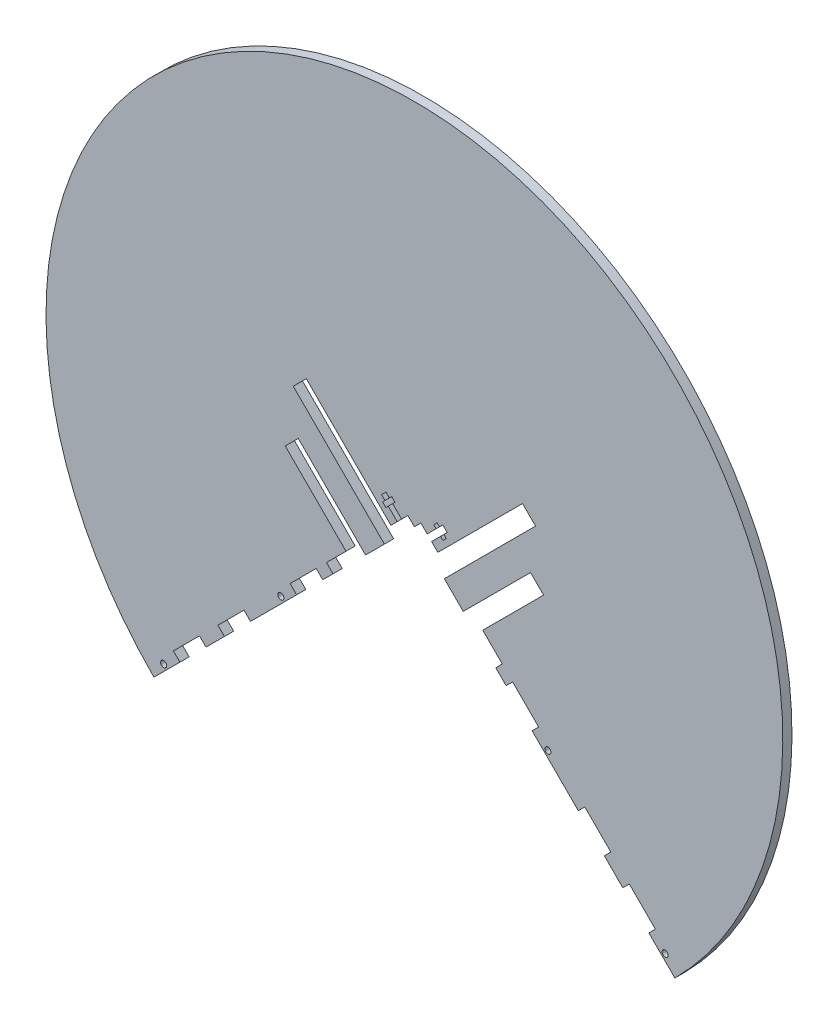
from build123d import *

# Parameters (mm, degrees)
SKETCH1_R           = 254
BOSS_EXTRUDE1_DEPTH = 6.35
CUT_EXTRUDE1_DEPTH  = 530.881249762
CUT_EXTRUDE2_DEPTH  = 466.964215177
SKETCH6_R           = 2.0955
CUT_EXTRUDE4_DEPTH  = 466.964215177
CUT_EXTRUDE6_DEPTH  = 466.964215177
CUT_EXTRUDE7_DEPTH  = 466.964215177
CUT_EXTRUDE8_DEPTH  = 466.964215177


with BuildPart() as part:
    # Sketch1 → Boss-Extrude1 (new body)
    with BuildSketch(Plane.XY):
        with Locations((0, -210.99227558)):
            Circle(SKETCH1_R)
    extrude(amount=BOSS_EXTRUDE1_DEPTH)

    # Sketch3 → Cut-Extrude1 (cut, through all)
    with BuildSketch(Plane(origin=(0, 0, 0), x_dir=(-1, 0, 0), z_dir=(0, 0, -1))):
        with BuildLine():
            Line((179.605122421, -390.597398001), (0, -210.99227558))
            Line((0, -210.99227558), (-179.605122421, -390.597398001))
            ThreePointArc((-179.605122421, -390.597398001), (0, -464.99227558), (179.605122421, -390.597398001))
        make_face()
    extrude(amount=-CUT_EXTRUDE1_DEPTH, mode=Mode.SUBTRACT)

    # Sketch4 → Cut-Extrude2 (cut, through all)
    with BuildSketch(Plane.XY.offset(6.35)):
        Polygon((-161.644610179, -372.636885759), (-166.13473824, -368.146757699), (-148.174225998, -350.186245456), (-143.684097937, -354.676373517), align=None)
        Polygon((-130.96805527, -341.960330849), (-135.45818333, -337.470202789), (-117.497671088, -319.509690547), (-113.007543028, -323.999818607), align=None)
        Polygon((-81.190495591, -292.18277117), (-85.680623651, -287.69264311), (-67.720111409, -269.732130868), (-63.229983348, -274.222258928), align=None)
        Polygon((-56.126600757, -267.118876336), (-60.616728817, -262.628748276), (-38.166088515, -240.178107973), (-33.675960454, -244.668236034), align=None)
        Polygon((-11.689323621, -222.681599201), (-16.179451682, -218.19147114), (-4.490128061, -206.502147519), (0, -210.99227558), align=None)
    cut_extrude2 = extrude(amount=-CUT_EXTRUDE2_DEPTH, mode=Mode.SUBTRACT)

    # Mirror1: Cut-Extrude2 across plane
    add(cut_extrude2.mirror(Plane(origin=(0, 0, 0), x_dir=(0, 0, 1), z_dir=(1, 0, 0))), mode=Mode.SUBTRACT)

    # Sketch6 → Cut-Extrude4 (cut, through all)
    with BuildSketch(Plane.XY.offset(6.35)):
        with Locations((-172.869930331, -379.37207785)):
            Circle(SKETCH6_R)
        with Locations((-92.047625241, -298.54977276)):
            Circle(SKETCH6_R)
    cut_extrude4 = extrude(amount=-CUT_EXTRUDE4_DEPTH, mode=Mode.SUBTRACT)

    # Mirror2: Cut-Extrude4 across plane
    add(cut_extrude4.mirror(Plane(origin=(0, 0, 0), x_dir=(0, 0, 1), z_dir=(1, 0, 0))), mode=Mode.SUBTRACT)

    # Sketch8 → Cut-Extrude6 (cut, through all)
    with BuildSketch(Plane.XY.offset(6.35)):
        Polygon((-20.669579742, -231.661855322), (-11.689323621, -222.681599201), (-74.551116468, -159.819806353), (-83.53137259, -168.800062475), align=None)
    cut_extrude6 = extrude(amount=-CUT_EXTRUDE6_DEPTH, mode=Mode.SUBTRACT)

    # Mirror3: Cut-Extrude6 across plane
    add(cut_extrude6.mirror(Plane(origin=(0, 0, 0), x_dir=(0, 0, 1), z_dir=(1, 0, 0))), mode=Mode.SUBTRACT)

    # Sketch9 → Cut-Extrude7 (cut, through all)
    with BuildSketch(Plane.XY.offset(6.35)):
        Polygon((-11.843472899, -213.855492358), (-8.826106843, -210.838126301), (-15.022483566, -204.641749578), (-13.388076952, -203.007342964), (-15.633140982, -200.762278934), (-17.267547597, -202.396685548), (-19.602414188, -200.061818956), (-22.619780245, -203.079185013), (-20.284913653, -205.414051604), (-21.919320267, -207.048458218), (-19.674256237, -209.293522249), (-18.039849623, -207.659115635), align=None)
    cut_extrude7 = extrude(amount=-CUT_EXTRUDE7_DEPTH, mode=Mode.SUBTRACT)

    # Mirror4: Cut-Extrude7 across plane
    add(cut_extrude7.mirror(Plane(origin=(0, 0, 0), x_dir=(0, 0, 1), z_dir=(1, 0, 0))), mode=Mode.SUBTRACT)

    # Sketch10 → Cut-Extrude8 (cut, through all)
    with BuildSketch(Plane.XY.offset(6.35)):
        Polygon((-80.080712821, -198.263483667), (-89.060968942, -207.243739788), (-42.656216575, -253.648492155), (-33.675960454, -244.668236034), align=None)
    cut_extrude8 = extrude(amount=-CUT_EXTRUDE8_DEPTH, mode=Mode.SUBTRACT)

    # Mirror5: Cut-Extrude8 across plane
    add(cut_extrude8.mirror(Plane(origin=(0, 0, 0), x_dir=(0, 0, 1), z_dir=(1, 0, 0))), mode=Mode.SUBTRACT)


solid = part.part
